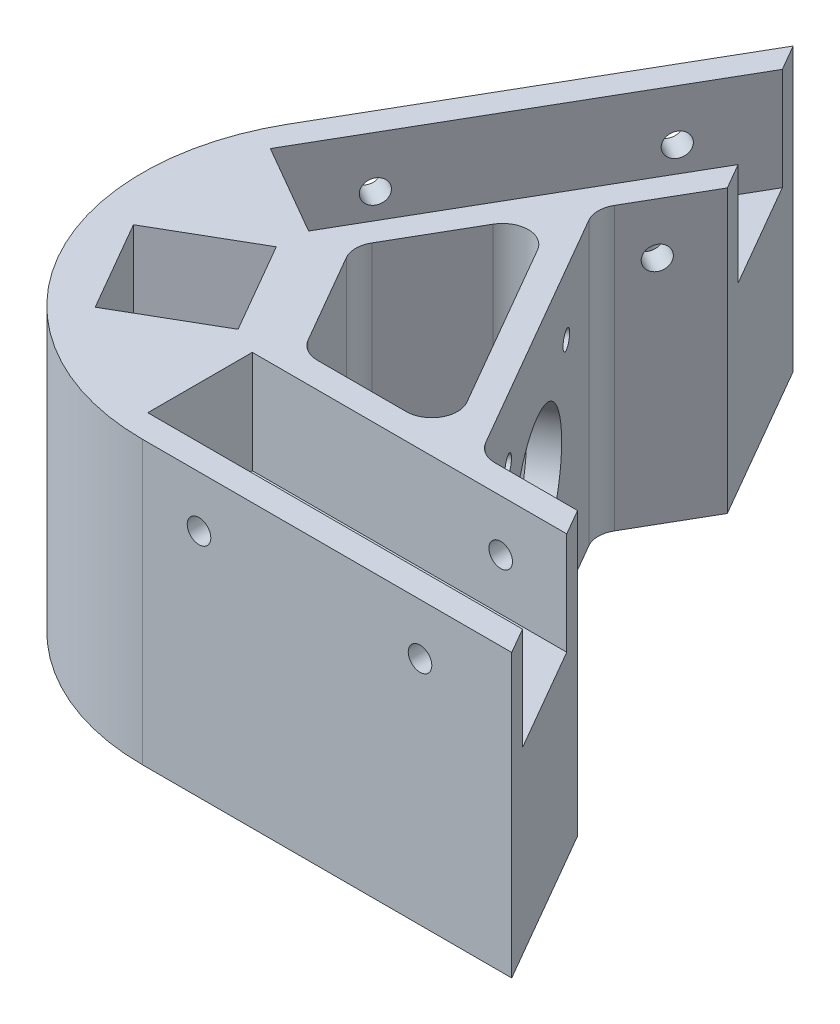
from build123d import *

# Parameters (mm, degrees)
BOSS_EXTRUDE1_DEPTH     = 55
CUT_EXTRUDE2_DEPTH      = 206.91260282
CUT_EXTRUDE2_DEPTH_BACK = 206.91260282
SKETCH2_W               = 100.4
SKETCH2_H               = 20.4
CUT_EXTRUDE3_DEPTH      = 20
FILLET1_R               = 45
CUT_EXTRUDE4_DEPTH      = 206.91260282
CUT_EXTRUDE4_DEPTH_BACK = 206.91260282
BOSS_EXTRUDE2_DEPTH     = 55
SKETCH29_R              = 1.75
SKETCH29_R_2            = 13
CUT_EXTRUDE5_DEPTH      = 10
SKETCH33_R              = 2.3
CUT_EXTRUDE9_DEPTH      = 10
SKETCH34_R              = 2.3
CUT_EXTRUDE10_DEPTH     = 10
FILLET2_R               = 5
CUT_EXTRUDE6_DEPTH      = 5
FILLET3_START           = 72
FILLET3_DEPTH           = 42
FILLET3_START_2         = 73.456949031
FILLET3_2_DEPTH         = 10
FILLET3_START_3         = 108.456949031
FILLET3_3_DEPTH         = 5
SKETCH31_R              = 2.3
CUT_EXTRUDE7_DEPTH      = 10
SKETCH32_R              = 2.3
CUT_EXTRUDE8_DEPTH      = 10
SKETCH35_R              = 2.3
CUT_EXTRUDE11_DEPTH     = 157.645539016
SKETCH36_R              = 4
CUT_EXTRUDE12_DEPTH     = 161.275509096
SKETCH37_R              = 2.1
CUT_EXTRUDE13_DEPTH     = 15
SKETCH38_R              = 2.3
CUT_EXTRUDE14_DEPTH     = 202.494416813
SKETCH39_R              = 4
CUT_EXTRUDE15_DEPTH     = 31
CHAMFER1_SIZE           = 1


with BuildPart() as part:
    # Sketch1 → Boss-Extrude1 (new body)
    with BuildSketch(Plane(origin=(0, 0, 0), x_dir=(1, 0, 0), z_dir=(0, 1, 0))):
        Polygon((0, 0), (150, 0), (75, 129.903810568), align=None)
    extrude(amount=-BOSS_EXTRUDE1_DEPTH)

    # Sketch4 → Cut-Extrude2 (cut, two sides: drawn at the far end of the back side and taken through both)
    with BuildSketch(Plane(origin=(0, 0, 0), x_dir=(1, 0, 0), z_dir=(0, 1, 0)).offset(-CUT_EXTRUDE2_DEPTH_BACK)):
        Polygon((58.511973189, 45.566570047), (40.845863577, 35.365169595), (51.047264029, 17.699059984), (68.713373641, 27.900460435), align=None)
    extrude(amount=CUT_EXTRUDE2_DEPTH + CUT_EXTRUDE2_DEPTH_BACK, mode=Mode.SUBTRACT)

    # Sketch2 → Cut-Extrude3 (cut)
    with BuildSketch(Plane(origin=(0, 0, 0), x_dir=(1, 0, 0), z_dir=(0, 1, 0))):
        Polygon((109.197045256, 138.33483042), (58.997045256, 51.38587988), (41.330127019, 61.58587988), (91.530127019, 148.53483042), align=None)
        with Locations((124.2, 15.2)):
            Rectangle(SKETCH2_W, SKETCH2_H)
    extrude(amount=-CUT_EXTRUDE3_DEPTH, mode=Mode.SUBTRACT)

    # Fillet1
    fillet1_edges = [part.edges().sort_by_distance(p)[0] for p in [
        (0, -27.5, 0),
    ]]
    fillet(fillet1_edges, radius=FILLET1_R)

    # Sketch27 → Cut-Extrude4 (cut, two sides: drawn at the far end of the back side and taken through both)
    with BuildSketch(Plane(origin=(0, 0, 0), x_dir=(1, 0, 0), z_dir=(0, 1, 0)).offset(-CUT_EXTRUDE4_DEPTH_BACK)):
        Polygon((238.272822489, 351.900634614), (92.551448183, 99.503810568), (65.734741667, 53.05591239), (78.81753352, 30.4), (132.448551817, 30.4), (423.891300428, 30.4), (928.68494852, 321.842748611), (743.066470581, 643.343383225), align=None)
    extrude(amount=CUT_EXTRUDE4_DEPTH + CUT_EXTRUDE4_DEPTH_BACK, mode=Mode.SUBTRACT)

    # Sketch28 → Boss-Extrude2 (add)
    with BuildSketch(Plane(origin=(0, 0, 0), x_dir=(1, 0, 0), z_dir=(0, 1, 0))):
        Polygon((83.054457118, 83.054539524), (113.460135283, 30.4), (107.686368323, 30.4), (80.167837876, 78.054768335), align=None)
    extrude(amount=-BOSS_EXTRUDE2_DEPTH)

    # Sketch29 → Cut-Extrude5 (cut)
    with BuildSketch(Plane(origin=(98.252102834, 0, -56.73626329), x_dir=(-0.5000686496051991, 0, -0.8659857652883405), z_dir=(0.8659857652883404, 0, -0.500068649605199))):
        with Locations((-15.510385308, -12)):
            Circle(SKETCH29_R)
        with Locations((15.489614692, -12)):
            Circle(SKETCH29_R)
        with Locations((15.489614692, -43)):
            Circle(SKETCH29_R)
        with Locations((-15.510385308, -43)):
            Circle(SKETCH29_R)
        with Locations((-0.010385308, -27.5)):
            Circle(SKETCH29_R_2)
    extrude(amount=-CUT_EXTRUDE5_DEPTH, mode=Mode.SUBTRACT)

    # Sketch33 → Cut-Extrude9 (cut)
    with BuildSketch(Plane(origin=(26.327172275, 0, 15.2), x_dir=(0.4999999999999997, 0, -0.8660254037844388), z_dir=(0.8660254037844389, 0, 0.49999999999999983))):
        with Locations((122.448551817, -10)):
            Circle(SKETCH33_R)
    extrude(amount=-CUT_EXTRUDE9_DEPTH, mode=Mode.SUBTRACT)

    # Sketch34 → Cut-Extrude10 (cut)
    with BuildSketch(Plane(origin=(0, 0, -30.4), x_dir=(-1, 0, 0), z_dir=(0, 0, -1))):
        with Locations((-122.448551817, -10)):
            Circle(SKETCH34_R)
    extrude(amount=-CUT_EXTRUDE10_DEPTH, mode=Mode.SUBTRACT)

    # Fillet2
    fillet2_edges = [part.edges().sort_by_distance(p)[0] for p in [
        (107.686368323, -27.5, -30.4),
        (113.460135283, -27.5, -30.4),
        (83.054457118, -27.5, -83.054539524),
        (80.167837876, -27.5, -78.054768335),
        (65.734741667, -27.5, -53.05591239),
        (78.81753352, -27.5, -30.4),
    ]]
    fillet(fillet2_edges, radius=FILLET2_R)

    # Sketch30 → Cut-Extrude6 (cut)
    with BuildSketch(Plane.XZ.offset(55)):
        Polygon((62.116998953, -39.323625207), (122.736002524, -74.32843068), (125.736414421, -69.132516088), (65.117410851, -34.127710616), align=None)
    extrude(amount=-CUT_EXTRUDE6_DEPTH, mode=Mode.SUBTRACT)

    # Fillet3: read off the stored shape, not the designer's step
    # Fillet3 outline → Fillet3 (cut)
    with BuildSketch(Plane(origin=(0, 0, 0), x_dir=(0.5000686496051991, 0, 0.8659857652883406), z_dir=(0.8659857652883404, 0, -0.5000686496051993)).offset(FILLET3_START)):
        with BuildLine():
            Line((-2.990935885, 55), (-5.490935885, 55))
            ThreePointArc((-5.490935885, 55), (-3.723168932, 54.267766953), (-2.990935885, 52.5))
            Line((-2.990935885, 52.5), (-2.990935885, 55))
        make_face()
        with BuildLine():
            Line((5.509064115, 55), (3.009064115, 55))
            Line((3.009064115, 55), (3.009064115, 52.5))
            ThreePointArc((3.009064115, 52.5), (3.741297162, 54.267766953), (5.509064115, 55))
        make_face()
    extrude(amount=FILLET3_DEPTH, mode=Mode.SUBTRACT)

    # Fillet3 2 outline → Fillet3 2 (add)
    with BuildSketch(Plane(origin=(0, 0, 0), x_dir=(0.5000686496051991, 0, 0.8659857652883406), z_dir=(0.8659857652883404, 0, -0.5000686496051993)).offset(FILLET3_START_2)):
        with BuildLine():
            ThreePointArc((-0.490935885, 50), (-2.258702838, 50.732233047), (-2.990935885, 52.5))
            Line((-2.990935885, 52.5), (-2.990935885, 50))
            Line((-2.990935885, 50), (-0.490935885, 50))
        make_face()
        with BuildLine():
            ThreePointArc((3.009064115, 52.5), (2.276831068, 50.732233047), (0.509064115, 50))
            Line((0.509064115, 50), (3.009064115, 50))
            Line((3.009064115, 50), (3.009064115, 52.5))
        make_face()
    extrude(amount=FILLET3_2_DEPTH)

    # Fillet3 3 outline → Fillet3 3 (add)
    with BuildSketch(Plane(origin=(0, 0, 0), x_dir=(0.5000686496051991, 0, 0.8659857652883406), z_dir=(0.8659857652883404, 0, -0.5000686496051993)).offset(FILLET3_START_3)):
        with BuildLine():
            ThreePointArc((-0.490935885, 50), (-2.258702838, 50.732233047), (-2.990935885, 52.5))
            Line((-2.990935885, 52.5), (-2.990935885, 50))
            Line((-2.990935885, 50), (-0.490935885, 50))
        make_face()
        with BuildLine():
            ThreePointArc((3.009064115, 52.5), (2.276831068, 50.732233047), (0.509064115, 50))
            Line((0.509064115, 50), (3.009064115, 50))
            Line((3.009064115, 50), (3.009064115, 52.5))
        make_face()
    extrude(amount=FILLET3_3_DEPTH)

    # Sketch31 → Cut-Extrude7 (cut)
    with BuildSketch(Plane(origin=(4.330127019, 0, 2.5), x_dir=(0.5000000000000019, 0, -0.8660254037844376), z_dir=(0.8660254037844376, 0, 0.5000000000000019))):
        with Locations((89, -10)):
            Circle(SKETCH31_R)
        with Locations((132.113248654, -10)):
            Circle(SKETCH31_R)
    extrude(amount=-CUT_EXTRUDE7_DEPTH, mode=Mode.SUBTRACT)

    # Sketch32 → Cut-Extrude8 (cut)
    with BuildSketch(Plane(origin=(0, 0, -5), x_dir=(-1, 0, 0), z_dir=(0, 0, -1))):
        with Locations((-132.113248654, -10)):
            Circle(SKETCH32_R)
        with Locations((-89, -10)):
            Circle(SKETCH32_R)
    extrude(amount=-CUT_EXTRUDE8_DEPTH, mode=Mode.SUBTRACT)

    # Sketch35 → Cut-Extrude11 (cut, through all)
    with BuildSketch(Plane(origin=(45.946562611, 0, -26.532116854), x_dir=(-0.5000686496051995, 0, -0.8659857652883403), z_dir=(0.8659857652883401, 0, -0.5000686496051994))):
        with Locations((0, -15)):
            Circle(SKETCH35_R)
        with Locations((0, -40)):
            Circle(SKETCH35_R)
    extrude(amount=-CUT_EXTRUDE11_DEPTH, mode=Mode.SUBTRACT)

    # Sketch36 → Cut-Extrude12 (cut, through all)
    with BuildSketch(Plane(origin=(42.482619549, 0, -24.531842256), x_dir=(-0.5000686496051995, 0, -0.8659857652883403), z_dir=(0.8659857652883401, 0, -0.5000686496051994))):
        with Locations((0, -15)):
            Circle(SKETCH36_R)
        with Locations((0, -40)):
            Circle(SKETCH36_R)
    extrude(amount=-CUT_EXTRUDE12_DEPTH, mode=Mode.SUBTRACT)

    # Sketch37 → Cut-Extrude13 (cut)
    with BuildSketch(Plane.XZ.offset(55)):
        with Locations(Location((69.166562249, -15.2, 0), (0, 0, 270))):
            Circle(SKETCH37_R)
        with Locations(Location((105.195419079, -15.2, 0), (0, 0, 270))):
            Circle(SKETCH37_R)
        with Locations(Location((47.746867262, -52.3, 0), (0, 0, 270))):
            Circle(SKETCH37_R)
        with Locations(Location((65.761295677, -83.501905284, 0), (0, 0, 270))):
            Circle(SKETCH37_R)
    extrude(amount=-CUT_EXTRUDE13_DEPTH, mode=Mode.SUBTRACT)

    # Sketch38 → Cut-Extrude14 (cut, through all)
    with BuildSketch(Plane(origin=(0, -20, 0), x_dir=(1, 0, 0), z_dir=(0, 1, 0))):
        with Locations(Location((89, 15.2, 0), (0, 0, 270))):
            Circle(SKETCH38_R)
        with Locations(Location((126.224275908, 15.2, 0), (0, 0, 270))):
            Circle(SKETCH38_R)
        with Locations(Location((76.275724092, 101.713429511, 0), (0, 0, 270))):
            Circle(SKETCH38_R)
        with Locations(Location((57.663586138, 69.476260937, 0), (0, 0, 270))):
            Circle(SKETCH38_R)
    extrude(amount=-CUT_EXTRUDE14_DEPTH, mode=Mode.SUBTRACT)

    # Sketch39 → Cut-Extrude15 (cut)
    with BuildSketch(Plane.XZ.offset(55)):
        with Locations(Location((89, -15.2, 0), (0, 0, 270))):
            Circle(SKETCH39_R)
        with Locations(Location((126.224275908, -15.2, 0), (0, 0, 270))):
            Circle(SKETCH39_R)
        with Locations(Location((57.663586138, -69.476260937, 0), (0, 0, 270))):
            Circle(SKETCH39_R)
        with Locations(Location((76.275724092, -101.713429511, 0), (0, 0, 270))):
            Circle(SKETCH39_R)
    extrude(amount=-CUT_EXTRUDE15_DEPTH, mode=Mode.SUBTRACT)

    # Chamfer1
    chamfer1_edges = [part.edges().sort_by_distance(p)[0] for p in [
        (105.195419079, -55, -13.1),
        (69.166562249, -55, -13.1),
        (47.746867262, -55, -50.2),
        (65.761295677, -55, -81.401905284),
    ]]
    chamfer(chamfer1_edges, length=CHAMFER1_SIZE)


solid = part.part
